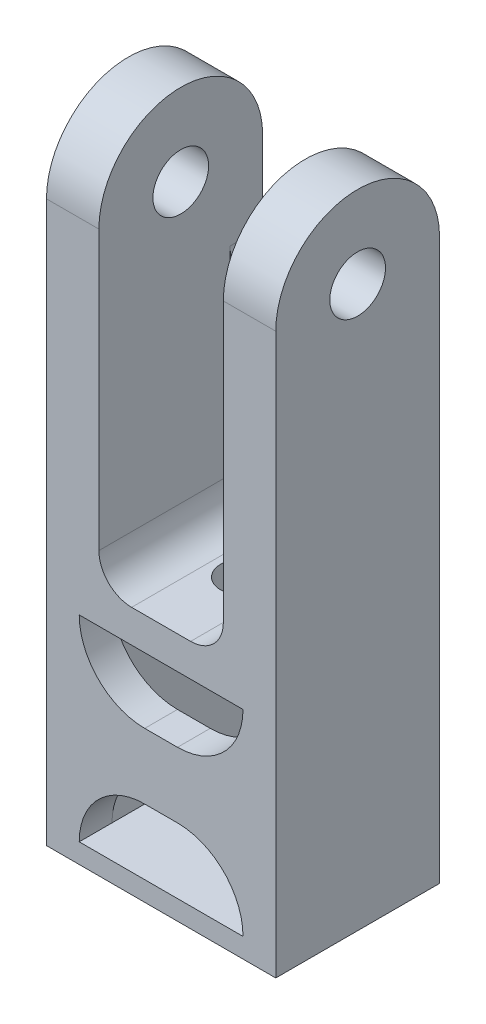
from build123d import *

# Parameters (mm, degrees)
SKETCH1_W           = 35
SKETCH1_H           = 100
BOSS_EXTRUDE1_DEPTH = 25
SKETCH2_W           = 19
SKETCH2_H           = 120
CUT_EXTRUDE1_DEPTH  = 25
FILLET2_RADIUS      = 12.5
FILLET2_LENGTH      = 8
FILLET3_RADIUS      = 12.5
FILLET3_LENGTH      = 8
SKETCH3_R           = 3.4
CUT_EXTRUDE2_DEPTH  = 70
SKETCH4_R           = 4.25
CUT_EXTRUDE3_DEPTH  = 45
SKETCH5_W           = 25
SKETCH5_H           = 30
CUT_EXTRUDE4_DEPTH  = 20
CHAMFER1_SIZE       = 2
FILLET4_R           = 5
SKETCH6_W           = 25
SKETCH6_H           = 10
CUT_EXTRUDE5_DEPTH  = 108.819293264
FILLET5_R           = 10
SKETCH7_W           = 19
SKETCH7_H           = 10
BOSS_EXTRUDE2_DEPTH = 5
FILLET6_R           = 4


with BuildPart() as part:
    # Sketch1 → Boss-Extrude1 (new body)
    with BuildSketch(Plane.XY):
        with Locations((17.5, 50)):
            Rectangle(SKETCH1_W, SKETCH1_H)
    extrude(amount=BOSS_EXTRUDE1_DEPTH)

    # Sketch2 → Cut-Extrude1 (cut)
    with BuildSketch(Plane.XY.offset(25)):
        with Locations((17.5, 100)):
            Rectangle(SKETCH2_W, SKETCH2_H)
    extrude(amount=-CUT_EXTRUDE1_DEPTH, mode=Mode.SUBTRACT)

    # Fillet2: full round fillet: the end face becomes a half cylinder, R = half its width
    fillet2_face = Plane((31, 100, 12.5), x_dir=(1, 0, 0), z_dir=(0, 1, 0))  # on the end face: x along it, z out of the body
    fillet2_slab = fillet2_face.offset(-FILLET2_RADIUS / 2) * Box(FILLET2_LENGTH, 2 * FILLET2_RADIUS, FILLET2_RADIUS, mode=Mode.PRIVATE)  # the body's end, R deep
    fillet2_round = Plane((31, 87.5, 12.5), x_dir=(0, 1, 0), z_dir=(1, 0, 0)) * Cylinder(FILLET2_RADIUS, FILLET2_LENGTH, mode=Mode.PRIVATE)  # its axis R under the face
    add(fillet2_slab - fillet2_round, mode=Mode.SUBTRACT)

    # Fillet3: full round fillet: the end face becomes a half cylinder, R = half its width
    fillet3_face = Plane((4, 100, 12.5), x_dir=(-1, 0, 0), z_dir=(0, 1, 0))  # on the end face: x along it, z out of the body
    fillet3_slab = fillet3_face.offset(-FILLET3_RADIUS / 2) * Box(FILLET3_LENGTH, 2 * FILLET3_RADIUS, FILLET3_RADIUS, mode=Mode.PRIVATE)  # the body's end, R deep
    fillet3_round = Plane((4, 87.5, 12.5), x_dir=(0, 1, 0), z_dir=(-1, 0, 0)) * Cylinder(FILLET3_RADIUS, FILLET3_LENGTH, mode=Mode.PRIVATE)  # its axis R under the face
    add(fillet3_slab - fillet3_round, mode=Mode.SUBTRACT)

    # Sketch3 → Cut-Extrude2 (cut)
    with BuildSketch(Plane.XZ):
        with Locations(Location((17.5, 12.5, 0), (0, 0, 270))):
            Circle(SKETCH3_R)
    extrude(amount=-CUT_EXTRUDE2_DEPTH, mode=Mode.SUBTRACT)

    # Sketch4 → Cut-Extrude3 (cut)
    with BuildSketch(Plane(origin=(35, 0, 0), x_dir=(0, 0, -1), z_dir=(1, 0, 0))):
        with Locations((-12.5, 87.5)):
            Circle(SKETCH4_R)
    extrude(amount=-CUT_EXTRUDE3_DEPTH, mode=Mode.SUBTRACT)

    # Sketch5 → Cut-Extrude4 (cut)
    with BuildSketch(Plane(origin=(0, 0, 0), x_dir=(-1, 0, 0), z_dir=(0, 0, -1))):
        with Locations((-17.5, 20)):
            Rectangle(SKETCH5_W, SKETCH5_H)
    extrude(amount=-CUT_EXTRUDE4_DEPTH, mode=Mode.SUBTRACT)

    # Chamfer1
    chamfer1_edges = [part.edges().sort_by_distance(p)[0] for p in [
        (17.5, 0, 0),
        (35, 0, 12.5),
        (0, 0, 12.5),
        (17.5, 0, 25),
    ]]
    chamfer(chamfer1_edges, length=CHAMFER1_SIZE)

    # Fillet4
    fillet4_edges = [part.edges().sort_by_distance(p)[0] for p in [
        (8, 40, 12.5),
        (27, 40, 12.5),
    ]]
    fillet(fillet4_edges, radius=FILLET4_R)

    # Sketch6 → Cut-Extrude5 (cut, through all)
    with BuildSketch(Plane(origin=(0, 0, 20), x_dir=(-1, 0, 0), z_dir=(0, 0, -1))):
        with Locations((-17.5, 30)):
            Rectangle(SKETCH6_W, SKETCH6_H)
        with Locations((-17.5, 10)):
            Rectangle(SKETCH6_W, SKETCH6_H)
    extrude(amount=-CUT_EXTRUDE5_DEPTH, mode=Mode.SUBTRACT)

    # Fillet5
    fillet5_edges = [part.edges().sort_by_distance(p)[0] for p in [
        (30, 15, 22.5),
        (30, 25, 22.5),
        (5, 25, 22.5),
        (5, 15, 22.5),
    ]]
    fillet(fillet5_edges, radius=FILLET5_R - 0.0001)  # a hair under: the kernel refuses the full size

    # Sketch7 → Boss-Extrude2 (add)
    with BuildSketch(Plane(origin=(0, 0, 0), x_dir=(-1, 0, 0), z_dir=(0, 0, -1))):
        with Locations((-17.5, 66.25)):
            Rectangle(SKETCH7_W, SKETCH7_H)
    extrude(amount=-BOSS_EXTRUDE2_DEPTH)

    # Fillet6
    fillet6_edges = [part.edges().sort_by_distance(p)[0] for p in [
        (8, 71.25, 2.5),
        (8, 61.25, 2.5),
        (27, 61.25, 2.5),
        (27, 71.25, 2.5),
    ]]
    fillet(fillet6_edges, radius=FILLET6_R)


solid = part.part
